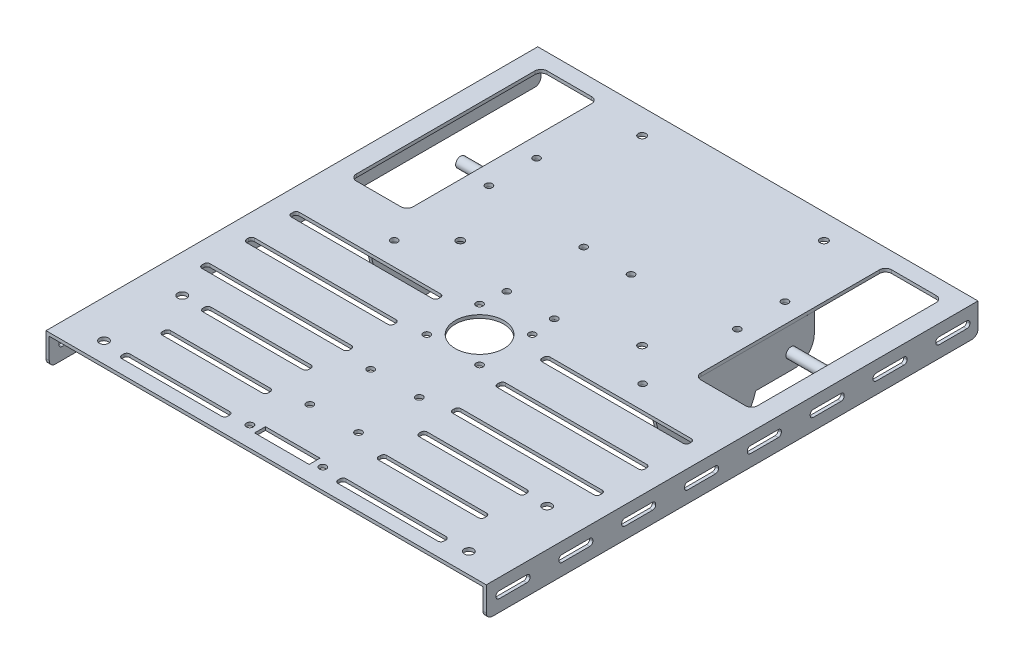
from build123d import *
from build123d.topology import SkipClean

# Parameters (mm, degrees)
SKETCH2_W                = 214
SKETCH2_H                = 242.598214609
SKETCH2_W_2              = 28
SKETCH2_H_2              = 94.123856443
BOSS_EXTRUDE1_DEPTH      = 1.6
BOSS_EXTRUDE3_DEPTH      = 1.6129
SKETCH6_R                = 1.27
SKETCH6_R_2              = 3
SKETCH6_R_3              = 2.55
BOSS_EXTRUDE4_DEPTH      = 1.6129
SKETCH7_R                = 1.7
SKETCH7_R_2              = 1.9
SKETCH7_R_3              = 2.25
SKETCH7_W                = 13.463625334
SKETCH7_H                = 5.356881788
CUT_EXTRUDE1_DEPTH       = 10
BOSS_EXTRUDE6_DEPTH      = 169
BOSS_EXTRUDE6_DEPTH_BACK = 21
SKETCH9_R                = 2.5
SKETCH11_W               = 1.6
SKETCH11_H               = 242.598214609
BOSS_EXTRUDE7_DEPTH      = 15
CUT_EXTRUDE2_DEPTH       = 8
CUT_EXTRUDE3_DEPTH       = 222
FILLET1_R                = 3


with BuildPart() as part:
    # Sketch2 → Boss-Extrude1 (new body)
    with BuildSketch(Plane(origin=(0, 0, 0), x_dir=(1, 0, 0), z_dir=(0, 1, 0))):
        with Locations((-65.266187111, 33.085004396)):
            Rectangle(SKETCH2_W, SKETCH2_H)
        with Locations((-150.266187111, 99.322183479)):
            Rectangle(SKETCH2_W_2, SKETCH2_H_2, mode=Mode.SUBTRACT)
        with Locations((19.733812889, 99.322183479)):
            Rectangle(SKETCH2_W_2, SKETCH2_H_2, mode=Mode.SUBTRACT)
    extrude(amount=BOSS_EXTRUDE1_DEPTH)


with BuildPart() as body_2:
    # Sketch4 → Boss-Extrude3 (new body)
    with BuildSketch(Plane.XZ):
        with BuildLine():
            Line((-136.267333078, -111.229721788), (-136.267333078, -31.67181992))
            Line((-136.267333078, -31.67181992), (-123.429884942, -31.67181992))
            ThreePointArc((-123.429884942, -31.67181992), (-119.894351036, -33.136286014), (-118.429884942, -36.67181992))
            Line((-118.429884942, -36.67181992), (-118.429884942, -60.433571732))
            Line((-118.429884942, -60.433571732), (-81.180673519, -60.433571732))
            Line((-81.180673519, -60.433571732), (-81.180673519, -37.931289086))
            Line((-81.180673519, -37.931289086), (-72.766187111, -37.931289086))
            Line((-72.766187111, -37.931289086), (-72.766187111, -84.232527977))
            Line((-72.766187111, -84.232527977), (-81.180673519, -84.232527977))
            Line((-81.180673519, -84.232527977), (-81.180673519, -67.120259162))
            Line((-81.180673519, -67.120259162), (-118.426749597, -67.120259162))
            Line((-118.426749597, -67.120259162), (-118.426749597, -106.229721788))
            ThreePointArc((-118.426749597, -106.229721788), (-119.891215691, -109.765255694), (-123.426749597, -111.229721788))
            Line((-123.426749597, -111.229721788), (-136.267333078, -111.229721788))
        make_face()
    extrude(amount=BOSS_EXTRUDE3_DEPTH)

    # Sketch6 → Boss-Extrude4 (add)
    with BuildSketch(Plane(origin=(-136.267333078, 113.834921078, 0), x_dir=(0, -1, 0), z_dir=(1, 0, 0))):
        with BuildLine():
            Line((113.834921078, 111.229721788), (113.834921078, 31.67181992))
            Line((113.834921078, 31.67181992), (115.447821078, 31.67181992))
            Line((115.447821078, 31.67181992), (132.436476957, 35.606170437))
            ThreePointArc((132.436476957, 35.606170437), (151.461048761, 58.546855783), (133.404101078, 82.256685324))
            Line((133.404101078, 82.256685324), (133.404101078, 101.229721788))
            ThreePointArc((133.404101078, 101.229721788), (130.47516889, 108.3007896), (123.404101078, 111.229721788))
            Line((123.404101078, 111.229721788), (113.834921078, 111.229721788))
        make_face()
        with Locations((133.404101078, 71.838631562)):
            Circle(SKETCH6_R, mode=Mode.SUBTRACT)
        with Locations((123.193301078, 49.664431562)):
            Circle(SKETCH6_R, mode=Mode.SUBTRACT)
        with Locations((133.404101078, 49.664431562)):
            Circle(SKETCH6_R_2, mode=Mode.SUBTRACT)
        with Locations((143.614901078, 49.664431562)):
            Circle(SKETCH6_R, mode=Mode.SUBTRACT)
        with Locations((125.834921078, 99.788179708)):
            Circle(SKETCH6_R_3, mode=Mode.SUBTRACT)
    extrude(amount=BOSS_EXTRUDE4_DEPTH)


with BuildPart() as cut_extrude1_tool:
    # Sketch7 → Cut-Extrude1 (new, symmetric)
    with BuildSketch(Plane.XZ):
        with Locations((-126.540591338, -82.971852726)):
            Circle(SKETCH7_R)
        with Locations((-126.540591338, -36.259735802)):
            Circle(SKETCH7_R)
        with Locations((-76.973430315, -42.21938946)):
            Circle(SKETCH7_R)
        with Locations((-76.973430315, -80.126171418)):
            Circle(SKETCH7_R)
        with Locations((-126.540591338, -106.479240424)):
            Circle(SKETCH7_R)
        with Locations((-110.116187111, -52.429944497)):
            Circle(SKETCH7_R_2)
        with Locations((-110.116187111, -142.129944497)):
            Circle(SKETCH7_R_2)
        with Locations((-155.266187111, 39.570055503)):
            Circle(SKETCH7_R_3)
        with Locations((-78.266187111, -4.079944497)):
            Circle(SKETCH7_R)
        with Locations((-78.266187111, -30.079944497)):
            Circle(SKETCH7_R)
        with Locations((-83.266187111, 78.214102909)):
            Circle(SKETCH7_R)
        with Locations((-77.266187111, 24.634898886)):
            Circle(SKETCH7_R)
        with Locations((-77.266187111, 54.634898886)):
            Circle(SKETCH7_R)
        with Locations((-155.266187111, 78.214102909)):
            Circle(SKETCH7_R_3)
        with BuildLine():
            Line((-65.266187111, -5.079944497), (-65.266187111, -29.079944497))
            ThreePointArc((-65.266187111, -29.079944497), (-77.266187111, -17.079944497), (-65.266187111, -5.079944497))
        make_face()
        with Locations((-71.997999778, 77.779311165)):
            Rectangle(SKETCH7_W, SKETCH7_H)
    cut_extrude1 = extrude(amount=CUT_EXTRUDE1_DEPTH, both=True)


with BuildPart() as part_1:
    add(part.part)

    # Cut-Extrude1: cut by cut_extrude1_tool
    add(cut_extrude1_tool.part, mode=Mode.SUBTRACT)

    # Mirror2: Cut-Extrude1 across plane
    with SkipClean():  # the faces are left unmerged after this step: merging them gives an invalid solid
        add(cut_extrude1.mirror(Plane.ZY.offset(65.266187111)), mode=Mode.SUBTRACT)

    # Sketch11 → Boss-Extrude7 (add)
    with SkipClean():  # the faces are left unmerged after this step: merging them gives an invalid solid
        with BuildSketch(Plane(origin=(0, 1.6, 0), x_dir=(1, 0, 0), z_dir=(0, 1, 0))):
            with Locations((-173.066187111, 33.085004396)):
                Rectangle(SKETCH11_W, SKETCH11_H)
            with Locations((42.533812889, 33.085004396)):
                Rectangle(SKETCH11_W, SKETCH11_H)
        extrude(amount=-BOSS_EXTRUDE7_DEPTH)

    # Sketch12 → Cut-Extrude2 (cut)
    with SkipClean():  # the faces are left unmerged after this step: merging them gives an invalid solid
        with BuildSketch(Plane(origin=(0, 1.6, 0), x_dir=(1, 0, 0), z_dir=(0, 1, 0))):
            with BuildLine():
                Line((-161.993319344, 24.836229797), (-92.270296951, 24.836229797))
                ThreePointArc((-92.270296951, 24.836229797), (-91.209636779, 24.396889969), (-90.770296951, 23.336229797))
                Line((-90.770296951, 23.336229797), (-90.770296951, 22.336229797))
                ThreePointArc((-90.770296951, 22.336229797), (-91.209636779, 21.275569626), (-92.270296951, 20.836229797))
                Line((-92.270296951, 20.836229797), (-161.993319344, 20.836229797))
                ThreePointArc((-161.993319344, 20.836229797), (-163.053979515, 21.275569626), (-163.493319344, 22.336229797))
                Line((-163.493319344, 22.336229797), (-163.493319344, 23.336229797))
                ThreePointArc((-163.493319344, 23.336229797), (-163.053979515, 24.396889969), (-161.993319344, 24.836229797))
            make_face()
            with BuildLine():
                Line((-143.245819105, -37.474912082), (-93.977009275, -37.474912082))
                ThreePointArc((-93.977009275, -37.474912082), (-92.916349103, -37.91425191), (-92.477009275, -38.974912082))
                Line((-92.477009275, -38.974912082), (-92.477009275, -39.974912082))
                ThreePointArc((-92.477009275, -39.974912082), (-92.916349103, -41.035572254), (-93.977009275, -41.474912082))
                Line((-93.977009275, -41.474912082), (-143.245819105, -41.474912082))
                ThreePointArc((-143.245819105, -41.474912082), (-144.306479277, -41.035572254), (-144.745819105, -39.974912082))
                Line((-144.745819105, -39.974912082), (-144.745819105, -38.974912082))
                ThreePointArc((-144.745819105, -38.974912082), (-144.306479277, -37.91425191), (-143.245819105, -37.474912082))
            make_face()
            with BuildLine():
                Line((-161.993319344, -1.163770203), (-92.270296951, -1.163770203))
                ThreePointArc((-92.270296951, -1.163770203), (-91.209636779, -0.724430374), (-90.770296951, 0.336229797))
                Line((-90.770296951, 0.336229797), (-90.770296951, 1.336229797))
                ThreePointArc((-90.770296951, 1.336229797), (-91.209636779, 2.396889969), (-92.270296951, 2.836229797))
                Line((-92.270296951, 2.836229797), (-161.993319344, 2.836229797))
                ThreePointArc((-161.993319344, 2.836229797), (-163.053979515, 2.396889969), (-163.493319344, 1.336229797))
                Line((-163.493319344, 1.336229797), (-163.493319344, 0.336229797))
                ThreePointArc((-163.493319344, 0.336229797), (-163.053979515, -0.724430374), (-161.993319344, -1.163770203))
            make_face()
            with BuildLine():
                Line((-161.993319344, -23.163770203), (-92.270296951, -23.163770203))
                ThreePointArc((-92.270296951, -23.163770203), (-91.209636779, -22.724430374), (-90.770296951, -21.663770203))
                Line((-90.770296951, -21.663770203), (-90.770296951, -20.663770203))
                ThreePointArc((-90.770296951, -20.663770203), (-91.209636779, -19.603110031), (-92.270296951, -19.163770203))
                Line((-92.270296951, -19.163770203), (-161.993319344, -19.163770203))
                ThreePointArc((-161.993319344, -19.163770203), (-163.053979515, -19.603110031), (-163.493319344, -20.663770203))
                Line((-163.493319344, -20.663770203), (-163.493319344, -21.663770203))
                ThreePointArc((-163.493319344, -21.663770203), (-163.053979515, -22.724430374), (-161.993319344, -23.163770203))
            make_face()
            with BuildLine():
                Line((-143.245819105, -57.474912082), (-93.977009275, -57.474912082))
                ThreePointArc((-93.977009275, -57.474912082), (-92.916349103, -57.91425191), (-92.477009275, -58.974912082))
                Line((-92.477009275, -58.974912082), (-92.477009275, -59.974912082))
                ThreePointArc((-92.477009275, -59.974912082), (-92.916349103, -61.035572254), (-93.977009275, -61.474912082))
                Line((-93.977009275, -61.474912082), (-143.245819105, -61.474912082))
                ThreePointArc((-143.245819105, -61.474912082), (-144.306479277, -61.035572254), (-144.745819105, -59.974912082))
                Line((-144.745819105, -59.974912082), (-144.745819105, -58.974912082))
                ThreePointArc((-144.745819105, -58.974912082), (-144.306479277, -57.91425191), (-143.245819105, -57.474912082))
            make_face()
            with BuildLine():
                Line((-143.245819105, -77.474912082), (-93.977009275, -77.474912082))
                ThreePointArc((-93.977009275, -77.474912082), (-92.916349103, -77.91425191), (-92.477009275, -78.974912082))
                Line((-92.477009275, -78.974912082), (-92.477009275, -79.974912082))
                ThreePointArc((-92.477009275, -79.974912082), (-92.916349103, -81.035572254), (-93.977009275, -81.474912082))
                Line((-93.977009275, -81.474912082), (-143.245819105, -81.474912082))
                ThreePointArc((-143.245819105, -81.474912082), (-144.306479277, -81.035572254), (-144.745819105, -79.974912082))
                Line((-144.745819105, -79.974912082), (-144.745819105, -78.974912082))
                ThreePointArc((-144.745819105, -78.974912082), (-144.306479277, -77.91425191), (-143.245819105, -77.474912082))
            make_face()
            with BuildLine():
                Line((12.713444884, -81.474912082), (-36.555364947, -81.474912082))
                ThreePointArc((-36.555364947, -81.474912082), (-37.616025119, -81.035572254), (-38.055364947, -79.974912082))
                Line((-38.055364947, -79.974912082), (-38.055364947, -78.974912082))
                ThreePointArc((-38.055364947, -78.974912082), (-37.616025119, -77.91425191), (-36.555364947, -77.474912082))
                Line((-36.555364947, -77.474912082), (12.713444884, -77.474912082))
                ThreePointArc((12.713444884, -77.474912082), (13.774105055, -77.91425191), (14.213444884, -78.974912082))
                Line((14.213444884, -78.974912082), (14.213444884, -79.974912082))
                ThreePointArc((14.213444884, -79.974912082), (13.774105055, -81.035572254), (12.713444884, -81.474912082))
            make_face()
            with BuildLine():
                Line((12.713444884, -61.474912082), (-36.555364947, -61.474912082))
                ThreePointArc((-36.555364947, -61.474912082), (-37.616025119, -61.035572254), (-38.055364947, -59.974912082))
                Line((-38.055364947, -59.974912082), (-38.055364947, -58.974912082))
                ThreePointArc((-38.055364947, -58.974912082), (-37.616025119, -57.91425191), (-36.555364947, -57.474912082))
                Line((-36.555364947, -57.474912082), (12.713444884, -57.474912082))
                ThreePointArc((12.713444884, -57.474912082), (13.774105055, -57.91425191), (14.213444884, -58.974912082))
                Line((14.213444884, -58.974912082), (14.213444884, -59.974912082))
                ThreePointArc((14.213444884, -59.974912082), (13.774105055, -61.035572254), (12.713444884, -61.474912082))
            make_face()
            with BuildLine():
                Line((32.960945122, -20.663770203), (32.960945122, -21.663770203))
                ThreePointArc((32.960945122, -21.663770203), (32.521605294, -22.724430374), (31.460945122, -23.163770203))
                Line((31.460945122, -23.163770203), (-38.26207727, -23.163770203))
                ThreePointArc((-38.26207727, -23.163770203), (-39.322737442, -22.724430374), (-39.76207727, -21.663770203))
                Line((-39.76207727, -21.663770203), (-39.76207727, -20.663770203))
                ThreePointArc((-39.76207727, -20.663770203), (-39.322737442, -19.603110031), (-38.26207727, -19.163770203))
                Line((-38.26207727, -19.163770203), (31.460945122, -19.163770203))
                ThreePointArc((31.460945122, -19.163770203), (32.521605294, -19.603110031), (32.960945122, -20.663770203))
            make_face()
            with BuildLine():
                Line((32.960945122, 1.336229797), (32.960945122, 0.336229797))
                ThreePointArc((32.960945122, 0.336229797), (32.521605294, -0.724430374), (31.460945122, -1.163770203))
                Line((31.460945122, -1.163770203), (-38.26207727, -1.163770203))
                ThreePointArc((-38.26207727, -1.163770203), (-39.322737442, -0.724430374), (-39.76207727, 0.336229797))
                Line((-39.76207727, 0.336229797), (-39.76207727, 1.336229797))
                ThreePointArc((-39.76207727, 1.336229797), (-39.322737442, 2.396889969), (-38.26207727, 2.836229797))
                Line((-38.26207727, 2.836229797), (31.460945122, 2.836229797))
                ThreePointArc((31.460945122, 2.836229797), (32.521605294, 2.396889969), (32.960945122, 1.336229797))
            make_face()
            with BuildLine():
                Line((12.713444884, -41.474912082), (-36.555364947, -41.474912082))
                ThreePointArc((-36.555364947, -41.474912082), (-37.616025119, -41.035572254), (-38.055364947, -39.974912082))
                Line((-38.055364947, -39.974912082), (-38.055364947, -38.974912082))
                ThreePointArc((-38.055364947, -38.974912082), (-37.616025119, -37.91425191), (-36.555364947, -37.474912082))
                Line((-36.555364947, -37.474912082), (12.713444884, -37.474912082))
                ThreePointArc((12.713444884, -37.474912082), (13.774105055, -37.91425191), (14.213444884, -38.974912082))
                Line((14.213444884, -38.974912082), (14.213444884, -39.974912082))
                ThreePointArc((14.213444884, -39.974912082), (13.774105055, -41.035572254), (12.713444884, -41.474912082))
            make_face()
            with BuildLine():
                Line((31.460945122, 20.836229797), (-38.26207727, 20.836229797))
                ThreePointArc((-38.26207727, 20.836229797), (-39.322737442, 21.275569626), (-39.76207727, 22.336229797))
                Line((-39.76207727, 22.336229797), (-39.76207727, 23.336229797))
                ThreePointArc((-39.76207727, 23.336229797), (-39.322737442, 24.396889969), (-38.26207727, 24.836229797))
                Line((-38.26207727, 24.836229797), (31.460945122, 24.836229797))
                ThreePointArc((31.460945122, 24.836229797), (32.521605294, 24.396889969), (32.960945122, 23.336229797))
                Line((32.960945122, 23.336229797), (32.960945122, 22.336229797))
                ThreePointArc((32.960945122, 22.336229797), (32.521605294, 21.275569626), (31.460945122, 20.836229797))
            make_face()
        extrude(amount=-CUT_EXTRUDE2_DEPTH, mode=Mode.SUBTRACT)

    # Sketch13 → Cut-Extrude3 (cut)
    with SkipClean():  # the faces are left unmerged after this step: merging them gives an invalid solid
        with BuildSketch(Plane.ZY.offset(173.866187111)):
            with BuildLine():
                Line((-148.857825312, -4.111400281), (-135.10457725, -4.111400281))
                ThreePointArc((-135.10457725, -4.111400281), (-134.043917078, -4.550740109), (-133.60457725, -5.611400281))
                Line((-133.60457725, -5.611400281), (-133.60457725, -6.011400281))
                ThreePointArc((-133.60457725, -6.011400281), (-134.043917078, -7.072060453), (-135.10457725, -7.511400281))
                Line((-135.10457725, -7.511400281), (-148.857825312, -7.511400281))
                ThreePointArc((-148.857825312, -7.511400281), (-149.918485484, -7.072060453), (-150.357825312, -6.011400281))
                Line((-150.357825312, -6.011400281), (-150.357825312, -5.611400281))
                ThreePointArc((-150.357825312, -5.611400281), (-149.918485484, -4.550740109), (-148.857825312, -4.111400281))
            make_face()
            with BuildLine():
                Line((-102.60457725, -5.611400281), (-102.60457725, -6.011400281))
                ThreePointArc((-102.60457725, -6.011400281), (-103.043917078, -7.072060453), (-104.10457725, -7.511400281))
                Line((-104.10457725, -7.511400281), (-117.857825312, -7.511400281))
                ThreePointArc((-117.857825312, -7.511400281), (-118.918485484, -7.072060453), (-119.357825312, -6.011400281))
                Line((-119.357825312, -6.011400281), (-119.357825312, -5.611400281))
                ThreePointArc((-119.357825312, -5.611400281), (-118.918485484, -4.550740109), (-117.857825312, -4.111400281))
                Line((-117.857825312, -4.111400281), (-104.10457725, -4.111400281))
                ThreePointArc((-104.10457725, -4.111400281), (-103.043917078, -4.550740109), (-102.60457725, -5.611400281))
            make_face()
            with BuildLine():
                Line((-71.60457725, -5.611400281), (-71.60457725, -6.011400281))
                ThreePointArc((-71.60457725, -6.011400281), (-72.043917078, -7.072060453), (-73.10457725, -7.511400281))
                Line((-73.10457725, -7.511400281), (-86.857825312, -7.511400281))
                ThreePointArc((-86.857825312, -7.511400281), (-87.918485484, -7.072060453), (-88.357825312, -6.011400281))
                Line((-88.357825312, -6.011400281), (-88.357825312, -5.611400281))
                ThreePointArc((-88.357825312, -5.611400281), (-87.918485484, -4.550740109), (-86.857825312, -4.111400281))
                Line((-86.857825312, -4.111400281), (-73.10457725, -4.111400281))
                ThreePointArc((-73.10457725, -4.111400281), (-72.043917078, -4.550740109), (-71.60457725, -5.611400281))
            make_face()
            with BuildLine():
                Line((-40.60457725, -5.611400281), (-40.60457725, -6.011400281))
                ThreePointArc((-40.60457725, -6.011400281), (-41.043917078, -7.072060453), (-42.10457725, -7.511400281))
                Line((-42.10457725, -7.511400281), (-55.857825312, -7.511400281))
                ThreePointArc((-55.857825312, -7.511400281), (-56.918485484, -7.072060453), (-57.357825312, -6.011400281))
                Line((-57.357825312, -6.011400281), (-57.357825312, -5.611400281))
                ThreePointArc((-57.357825312, -5.611400281), (-56.918485484, -4.550740109), (-55.857825312, -4.111400281))
                Line((-55.857825312, -4.111400281), (-42.10457725, -4.111400281))
                ThreePointArc((-42.10457725, -4.111400281), (-41.043917078, -4.550740109), (-40.60457725, -5.611400281))
            make_face()
            with BuildLine():
                Line((-9.60457725, -5.611400281), (-9.60457725, -6.011400281))
                ThreePointArc((-9.60457725, -6.011400281), (-10.043917078, -7.072060453), (-11.10457725, -7.511400281))
                Line((-11.10457725, -7.511400281), (-24.857825312, -7.511400281))
                ThreePointArc((-24.857825312, -7.511400281), (-25.918485484, -7.072060453), (-26.357825312, -6.011400281))
                Line((-26.357825312, -6.011400281), (-26.357825312, -5.611400281))
                ThreePointArc((-26.357825312, -5.611400281), (-25.918485484, -4.550740109), (-24.857825312, -4.111400281))
                Line((-24.857825312, -4.111400281), (-11.10457725, -4.111400281))
                ThreePointArc((-11.10457725, -4.111400281), (-10.043917078, -4.550740109), (-9.60457725, -5.611400281))
            make_face()
            with BuildLine():
                Line((21.39542275, -5.611400281), (21.39542275, -6.011400281))
                ThreePointArc((21.39542275, -6.011400281), (20.956082922, -7.072060453), (19.89542275, -7.511400281))
                Line((19.89542275, -7.511400281), (6.142174688, -7.511400281))
                ThreePointArc((6.142174688, -7.511400281), (5.081514516, -7.072060453), (4.642174688, -6.011400281))
                Line((4.642174688, -6.011400281), (4.642174688, -5.611400281))
                ThreePointArc((4.642174688, -5.611400281), (5.081514516, -4.550740109), (6.142174688, -4.111400281))
                Line((6.142174688, -4.111400281), (19.89542275, -4.111400281))
                ThreePointArc((19.89542275, -4.111400281), (20.956082922, -4.550740109), (21.39542275, -5.611400281))
            make_face()
            with BuildLine():
                Line((52.39542275, -5.611400281), (52.39542275, -6.011400281))
                ThreePointArc((52.39542275, -6.011400281), (51.956082922, -7.072060453), (50.89542275, -7.511400281))
                Line((50.89542275, -7.511400281), (37.142174688, -7.511400281))
                ThreePointArc((37.142174688, -7.511400281), (36.081514516, -7.072060453), (35.642174688, -6.011400281))
                Line((35.642174688, -6.011400281), (35.642174688, -5.611400281))
                ThreePointArc((35.642174688, -5.611400281), (36.081514516, -4.550740109), (37.142174688, -4.111400281))
                Line((37.142174688, -4.111400281), (50.89542275, -4.111400281))
                ThreePointArc((50.89542275, -4.111400281), (51.956082922, -4.550740109), (52.39542275, -5.611400281))
            make_face()
            with BuildLine():
                Line((83.39542275, -5.611400281), (83.39542275, -6.011400281))
                ThreePointArc((83.39542275, -6.011400281), (82.956082922, -7.072060453), (81.89542275, -7.511400281))
                Line((81.89542275, -7.511400281), (68.142174688, -7.511400281))
                ThreePointArc((68.142174688, -7.511400281), (67.081514516, -7.072060453), (66.642174688, -6.011400281))
                Line((66.642174688, -6.011400281), (66.642174688, -5.611400281))
                ThreePointArc((66.642174688, -5.611400281), (67.081514516, -4.550740109), (68.142174688, -4.111400281))
                Line((68.142174688, -4.111400281), (81.89542275, -4.111400281))
                ThreePointArc((81.89542275, -4.111400281), (82.956082922, -4.550740109), (83.39542275, -5.611400281))
            make_face()
        extrude(amount=-CUT_EXTRUDE3_DEPTH, mode=Mode.SUBTRACT)

    # Fillet1
    fillet1_edges = [part_1.edges().sort_by_distance(p)[0] for p in [
        (-173.066187111, -13.4, 88.214102909),
        (-173.066187111, -13.4, -154.3841117),
        (42.533812889, -13.4, -154.3841117),
        (42.533812889, -13.4, 88.214102909),
        (-136.266187111, 0.8, -52.260255257),
        (-164.266187111, 0.8, -146.3841117),
        (-164.266187111, 0.8, -52.260255257),
        (-136.266187111, 0.8, -146.3841117),
        (33.733812889, 0.8, -146.3841117),
        (5.733812889, 0.8, -146.3841117),
        (33.733812889, 0.8, -52.260255257),
        (5.733812889, 0.8, -52.260255257),
    ]]
    fillet(fillet1_edges, radius=FILLET1_R)


with BuildPart() as body_2_1:
    add(body_2.part)

    # Cut-Extrude1: cut by cut_extrude1_tool
    add(cut_extrude1_tool.part, mode=Mode.SUBTRACT)


with BuildPart() as body_3:
    # Mirror1: mirrored copy
    add(body_2_1.part.mirror(Plane.ZY.offset(65.266187111)))


with BuildPart() as body_4:
    # Sketch9 → Boss-Extrude6 (new, two sides: drawn at the far end of the back side and taken through both)
    with BuildSketch(Plane(origin=(-136.266187111, 0, 0), x_dir=(0, 0, -1), z_dir=(1, 0, 0)).offset(-BOSS_EXTRUDE6_DEPTH_BACK)):
        with Locations((99.788179708, -12)):
            Circle(SKETCH9_R)
    extrude(amount=BOSS_EXTRUDE6_DEPTH + BOSS_EXTRUDE6_DEPTH_BACK)


solid = Compound([part_1.part, body_2_1.part, body_3.part, body_4.part])
